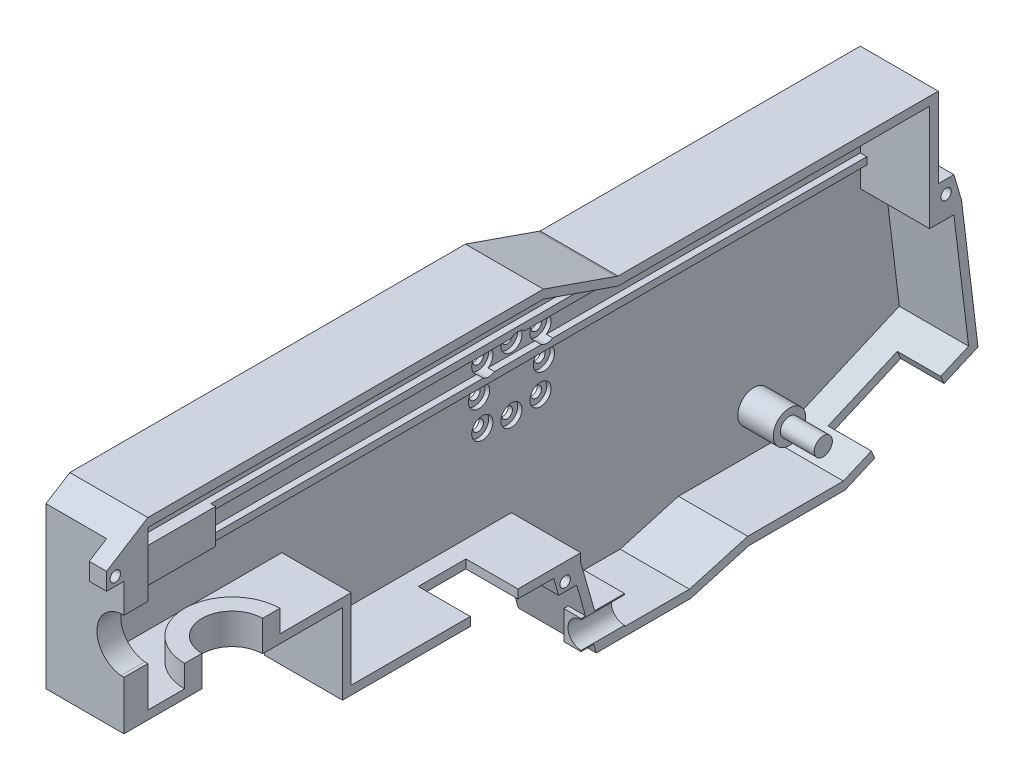
from build123d import *

# Parameters (mm, degrees)
SKETCH_1_W                   = 200
SKETCH_1_H                   = 65
SKETCH_1_R                   = 2.55
SKETCH_1_R_2                 = 2.2
EXTRUDE_1_DEPTH              = 2
SKETCH_2_W                   = 200
SKETCH_2_H                   = 2
EXTRUDE_2_DEPTH              = 16
SKETCH_3_R                   = 2.55
EXTRUDE_3_DEPTH              = 2.6
SKETCH_4_R                   = 4
SKETCH_4_R_2                 = 2.55
EXTRUDE_4_DEPTH              = 4.5
SKETCH_5_R                   = 2.2
EXTRUDE_5_DEPTH              = 16
SKETCH_6_R                   = 3.75
EXTRUDE_6_DEPTH              = 8.2
SKETCH_7_W                   = 200
SKETCH_7_H                   = 2
EXTRUDE_7_DEPTH              = 2
SKETCH_8_W                   = 165.45
SKETCH_8_H                   = 1.65
EXTRUDE_8_DEPTH              = 1.5
EXTRUDE_10_REACH             = 108.629
SKETCH_9_W                   = 5.5
SKETCH_9_H                   = 4
SKETCH_9_H_2                 = 4.5
SKETCH_9_H_3                 = 2
EXTRUDE_10_DIRECTION_2_REACH = 108.629
SKETCH_10_W                  = 5.5
SKETCH_10_H                  = 6.2
CUT_EXTRUDE_1_DEPTH          = 6.24
EXTRUDE_11_DEPTH             = 5.5
CUT_EXTRUDE_2_DEPTH          = 107.987148761
SKETCH_13_W                  = 2
SKETCH_13_H                  = 19
EXTRUDE_12_DEPTH             = 16
SKETCH_15_W                  = 11
SKETCH_15_H                  = 2
CUT_EXTRUDE_3_DEPTH          = 6.3
SKETCH_16_W                  = 7
SKETCH_16_H                  = 2
CUT_EXTRUDE_4_DEPTH          = 14
EXTRUDE_13_DEPTH             = 2
SKETCH_18_W                  = 14
SKETCH_18_H                  = 2
CUT_EXTRUDE_5_DEPTH          = 16
CUT_EXTRUDE_6_DEPTH          = 2
EXTRUDE_START                = -18
SKETCH_20_R                  = 25.5
SKETCH_20_R_2                = 22.7
EXTRUDE_14_DEPTH             = 24
SKETCH_21_W                  = 13
SKETCH_21_H                  = 4.7
EXTRUDE_15_DEPTH             = 2
SKETCH_22_R                  = 1.25
CUT_EXTRUDE_7_DEPTH          = 2
EXTRUDE_START_2              = 2
SKETCH_23_R                  = 22.7
SKETCH_23_R_2                = 1.25
EXTRUDE_17_DEPTH             = 2
CUT_EXTRUDE_START            = -16
CUT_EXTRUDE_10_DEPTH         = 16
CUT_EXTRUDE_START_2          = -17
CUT_EXTRUDE_10_2_OUTLINE_R   = 2.45
CUT_EXTRUDE_10_2_OUTLINE_R_2 = 1.25
CUT_EXTRUDE_10_2_DEPTH       = 1
EXTRUDE_START_3              = -1.5
EXTRUDE_18_DEPTH             = 1.5
SKETCH_28_W                  = 4
SKETCH_28_H                  = 4
SKETCH_28_R                  = 1.2
EXTRUDE_20_DEPTH             = 4
SKETCH_29_W                  = 4
SKETCH_29_H                  = 4
SKETCH_29_R                  = 1.2
EXTRUDE_21_DEPTH             = 4
EXTRUDE_22_DEPTH             = 4
SKETCH_31_W                  = 4
SKETCH_31_H                  = 4
SKETCH_31_R                  = 1.2
EXTRUDE_23_DEPTH             = 4
CUT_EXTRUDE_START_3          = -6
SKETCH_32_R                  = 25.5
CUT_EXTRUDE_11_DEPTH         = 6
CUT_EXTRUDE_12_DEPTH         = 16
SKETCH_35_W                  = 5.5
SKETCH_35_H                  = 3
SKETCH_35_W_2                = 2
SKETCH_35_H_2                = 2
EXTRUDE_26_DEPTH             = 16
EXTRUDE_START_4              = -2
EXTRUDE_30_DEPTH             = 2
SKETCH_38_W                  = 16
SKETCH_38_H                  = 5.5
EXTRUDE_31_DEPTH             = 6.3
CUT_EXTRUDE_START_4          = 5
CUT_EXTRUDE_13_DEPTH         = 5
CUT_EXTRUDE_START_5          = -5
CUT_EXTRUDE_14_DEPTH         = 5
CUT_EXTRUDE_15_DEPTH         = 9.7
SKETCH_42_W                  = 14
SKETCH_42_H                  = 2
CUT_EXTRUDE_17_DEPTH         = 12
EXTRUDE_35_REACH             = 113.212
EXTRUDE_35_DIRECTION_2_REACH = 113.212
EXTRUDE_36_DEPTH             = 2
CUT_EXTRUDE_18_DEPTH         = 2
EXTRUDE_37_REACH             = 114.296
SKETCH_47_W                  = 91.33315603
SKETCH_47_H                  = 4
EXTRUDE_38_DEPTH             = 2
SKETCH_48_W                  = 91.33315603
SKETCH_48_H                  = 2
CUT_EXTRUDE_19_DEPTH         = 16
CUT_EXTRUDE_20_DEPTH         = 14
CUT_EXTRUDE_21_DEPTH         = 16
SKETCH_51_R                  = 3.75
SKETCH_51_R_2                = 2.2
EXTRUDE_39_DEPTH             = 8.2
SKETCH_53_R                  = 2.1
EXTRUDE_40_DEPTH             = 7.8
SKETCH_54_R                  = 3.75
CUT_EXTRUDE_23_DEPTH         = 16
SKETCH_55_R                  = 2.2
EXTRUDE_42_DEPTH             = 2
EXTRUDE_43_DEPTH             = 4
SKETCH_57_W                  = 9
SKETCH_57_H                  = 2
EXTRUDE_44_DEPTH             = 12
SKETCH_58_W                  = 6
SKETCH_58_H                  = 2
CUT_EXTRUDE_24_DEPTH         = 12
CUT_EXTRUDE_START_6          = -4.5
SKETCH_59_R                  = 4
CUT_EXTRUDE_25_DEPTH         = 4.5
CUT_EXTRUDE_26_REACH         = 115.05
SKETCH_60_W                  = 12
SKETCH_60_H                  = 24.5
SKETCH_60_W_2                = 4
SKETCH_60_H_2                = 4
SKETCH_60_R                  = 1.2
SKETCH_61_W                  = 2
SKETCH_61_H                  = 28
CUT_EXTRUDE_27_DEPTH         = 114.049767802
EXTRUDE_45_DEPTH             = 18
CUT_EXTRUDE_28_DEPTH         = 10
SKETCH_64_R                  = 1.2
EXTRUDE_46_DEPTH             = 4
SKETCH_65_W                  = 5
SKETCH_65_H                  = 6.638569711
EXTRUDE_47_DEPTH             = 4
CUT_EXTRUDE_29_REACH         = 120.174
EXTRUDE_48_DEPTH             = 12
EXTRUDE_49_DEPTH             = 5.1


with BuildPart() as part:
    # 草图1 → 凸台-拉伸1 (new body)
    with BuildSketch(Plane(origin=(0, 0, 0), x_dir=(0, 0, -1), z_dir=(1, 0, 0))):
        Rectangle(SKETCH_1_W, SKETCH_1_H)
        with Locations((-88, 17.5)):
            Circle(SKETCH_1_R, mode=Mode.SUBTRACT)
        with Locations((61.45, -15.22)):
            Circle(SKETCH_1_R_2, mode=Mode.SUBTRACT)
    extrude(amount=EXTRUDE_1_DEPTH)

    # 草图3 → 凸台-拉伸3 (add)
    with BuildSketch(Plane(origin=(2, 0, 0), x_dir=(0, 0, -1), z_dir=(1, 0, 0))):
        Polygon((-65.45, 13.5), (-65.45, 17.5), (-65.45, 21.5), (-100, 21.5), (-100, 13.5), align=None)
        with Locations((-88, 17.5)):
            Circle(SKETCH_3_R, mode=Mode.SUBTRACT)
    extrude(amount=EXTRUDE_3_DEPTH)

    # 草图4 → 凸台-拉伸4 (add)
    with BuildSketch(Plane(origin=(4.6, 0, 0), x_dir=(0, 0, -1), z_dir=(1, 0, 0))):
        with Locations(Location((-88, 17.5, 0), (0, 0, 270))):
            Circle(SKETCH_4_R)
        with Locations((-88, 17.5)):
            Circle(SKETCH_4_R_2, mode=Mode.SUBTRACT)
    extrude(amount=EXTRUDE_4_DEPTH)



with BuildPart() as body_2:
    # 草图2 → 凸台-拉伸2 (new body)
    with BuildSketch(Plane(origin=(2, 0, 0), x_dir=(0, 0, -1), z_dir=(1, 0, 0))):
        with Locations((0, 33.5)):
            Rectangle(SKETCH_2_W, SKETCH_2_H)
    extrude(amount=EXTRUDE_2_DEPTH)


with BuildPart() as body_3:
    # 草图5 → 凸台-拉伸5 (new body)
    with BuildSketch(Plane(origin=(2, 0, 0), x_dir=(0, 0, -1), z_dir=(1, 0, 0))):
        with Locations((61.45, -15.22)):
            Circle(SKETCH_5_R)
    extrude(amount=EXTRUDE_5_DEPTH)


with BuildPart() as part_1:
    add(part.part)

    add(body_3.part)  # 凸台-拉伸6 merges body 3
    # 草图6 → 凸台-拉伸6 (add)
    with BuildSketch(Plane(origin=(2, 0, 0), x_dir=(0, 0, -1), z_dir=(1, 0, 0))):
        with Locations((61.45, -15.22)):
            Circle(SKETCH_6_R)
    extrude(amount=EXTRUDE_6_DEPTH)


    add(body_2.part)  # 凸台-拉伸7 merges body 2
    # 草图7 → 凸台-拉伸7 (add)
    with BuildSketch(Plane.ZY.offset(-2)):
        with Locations((0, 33.5)):
            Rectangle(SKETCH_7_W, SKETCH_7_H)
    extrude(amount=EXTRUDE_7_DEPTH)

    # 草图8 → 凸台-拉伸8 (add)
    with BuildSketch(Plane(origin=(2, 0, 0), x_dir=(0, 0, -1), z_dir=(1, 0, 0))):
        with Locations((17.275, 20.675)):
            Rectangle(SKETCH_8_W, SKETCH_8_H)
        with Locations((17.275, 14.325)):
            Rectangle(SKETCH_8_W, SKETCH_8_H)
    extrude(amount=EXTRUDE_8_DEPTH)

    # 凸台-拉伸10: up to this face of the body (flat: up to its plane)
    extrude_10_end = Plane(part_1.part.faces().sort_by_distance((18, 33.5, 0))[0])
    # 草图9 → 凸台-拉伸10 (add, up to the picked face)
    with BuildSketch(Plane(origin=(4.6, 0, 0), x_dir=(0, 0, -1), z_dir=(1, 0, 0)), mode=Mode.PRIVATE) as extrude_10_sk1:
        Polygon((-100, 21.5), (-94.5, 21.5), (-94.5, 32.5), (-100, 32.5), (-100, 28), align=None)
    extrude_10_tool1 = split(extrude(extrude_10_sk1.sketch, amount=EXTRUDE_10_REACH, mode=Mode.PRIVATE), bisect_by=extrude_10_end, keep=Keep.BOTH, mode=Mode.PRIVATE)
    # 草图9 → 凸台-拉伸10 (add, up to the picked face)
    with BuildSketch(Plane(origin=(4.6, 0, 0), x_dir=(0, 0, -1), z_dir=(1, 0, 0)), mode=Mode.PRIVATE) as extrude_10_sk2:
        with Locations((-97.25, 19.5)):
            Rectangle(SKETCH_9_W, SKETCH_9_H)
    extrude_10_tool2 = split(extrude(extrude_10_sk2.sketch, amount=EXTRUDE_10_REACH, mode=Mode.PRIVATE), bisect_by=extrude_10_end, keep=Keep.BOTH, mode=Mode.PRIVATE)
    # 草图9 → 凸台-拉伸10 (add, up to the picked face)
    with BuildSketch(Plane(origin=(4.6, 0, 0), x_dir=(0, 0, -1), z_dir=(1, 0, 0)), mode=Mode.PRIVATE) as extrude_10_sk3:
        with Locations((-97.25, 15.5)):
            Rectangle(SKETCH_9_W, SKETCH_9_H)
    extrude_10_tool3 = split(extrude(extrude_10_sk3.sketch, amount=EXTRUDE_10_REACH, mode=Mode.PRIVATE), bisect_by=extrude_10_end, keep=Keep.BOTH, mode=Mode.PRIVATE)
    # 草图9 → 凸台-拉伸10 (add, up to the picked face)
    with BuildSketch(Plane(origin=(4.6, 0, 0), x_dir=(0, 0, -1), z_dir=(1, 0, 0)), mode=Mode.PRIVATE) as extrude_10_sk4:
        with Locations((-97.25, 9.25)):
            Rectangle(SKETCH_9_W, SKETCH_9_H_2)
    extrude_10_tool4 = split(extrude(extrude_10_sk4.sketch, amount=EXTRUDE_10_REACH, mode=Mode.PRIVATE), bisect_by=extrude_10_end, keep=Keep.BOTH, mode=Mode.PRIVATE)
    # 草图9 → 凸台-拉伸10 (add, up to the picked face)
    with BuildSketch(Plane(origin=(4.6, 0, 0), x_dir=(0, 0, -1), z_dir=(1, 0, 0)), mode=Mode.PRIVATE) as extrude_10_sk5:
        with Locations((-97.25, 12.5)):
            Rectangle(SKETCH_9_W, SKETCH_9_H_3)
    extrude_10_tool5 = split(extrude(extrude_10_sk5.sketch, amount=EXTRUDE_10_REACH, mode=Mode.PRIVATE), bisect_by=extrude_10_end, keep=Keep.BOTH, mode=Mode.PRIVATE)
    add(extrude_10_tool1.solids().sort_by(Axis((4.6, 27, 97.25), (1, 0, 0)))[0])
    add(extrude_10_tool2.solids().sort_by(Axis((4.6, 19.5, 97.25), (1, 0, 0)))[0])
    add(extrude_10_tool3.solids().sort_by(Axis((4.6, 15.5, 97.25), (1, 0, 0)))[0])
    add(extrude_10_tool4.solids().sort_by(Axis((4.6, 9.25, 97.25), (1, 0, 0)))[0])
    add(extrude_10_tool5.solids().sort_by(Axis((4.6, 12.5, 97.25), (1, 0, 0)))[0])

    # 凸台-拉伸10 direction 2: up to this face of the body (flat: up to its plane)
    extrude_10_direction_2_end = Plane(part_1.part.faces().sort_by_distance((2, -9.47239987, 0.296508389))[0])
    # 草图9 → 凸台-拉伸10 direction 2 (add, up to the picked face)
    with BuildSketch(Plane(origin=(4.6, 0, 0), x_dir=(0, 0, -1), z_dir=(1, 0, 0)), mode=Mode.PRIVATE) as extrude_10_direction_2_sk1:
        Polygon((-100, 21.5), (-94.5, 21.5), (-94.5, 32.5), (-100, 32.5), (-100, 28), align=None)
    extrude_10_direction_2_tool1 = split(extrude(extrude_10_direction_2_sk1.sketch, amount=-EXTRUDE_10_DIRECTION_2_REACH, mode=Mode.PRIVATE), bisect_by=extrude_10_direction_2_end, keep=Keep.BOTH, mode=Mode.PRIVATE)
    # 草图9 → 凸台-拉伸10 direction 2 (add, up to the picked face)
    with BuildSketch(Plane(origin=(4.6, 0, 0), x_dir=(0, 0, -1), z_dir=(1, 0, 0)), mode=Mode.PRIVATE) as extrude_10_direction_2_sk2:
        with Locations((-97.25, 19.5)):
            Rectangle(SKETCH_9_W, SKETCH_9_H)
    extrude_10_direction_2_tool2 = split(extrude(extrude_10_direction_2_sk2.sketch, amount=-EXTRUDE_10_DIRECTION_2_REACH, mode=Mode.PRIVATE), bisect_by=extrude_10_direction_2_end, keep=Keep.BOTH, mode=Mode.PRIVATE)
    # 草图9 → 凸台-拉伸10 direction 2 (add, up to the picked face)
    with BuildSketch(Plane(origin=(4.6, 0, 0), x_dir=(0, 0, -1), z_dir=(1, 0, 0)), mode=Mode.PRIVATE) as extrude_10_direction_2_sk3:
        with Locations((-97.25, 15.5)):
            Rectangle(SKETCH_9_W, SKETCH_9_H)
    extrude_10_direction_2_tool3 = split(extrude(extrude_10_direction_2_sk3.sketch, amount=-EXTRUDE_10_DIRECTION_2_REACH, mode=Mode.PRIVATE), bisect_by=extrude_10_direction_2_end, keep=Keep.BOTH, mode=Mode.PRIVATE)
    # 草图9 → 凸台-拉伸10 direction 2 (add, up to the picked face)
    with BuildSketch(Plane(origin=(4.6, 0, 0), x_dir=(0, 0, -1), z_dir=(1, 0, 0)), mode=Mode.PRIVATE) as extrude_10_direction_2_sk4:
        with Locations((-97.25, 9.25)):
            Rectangle(SKETCH_9_W, SKETCH_9_H_2)
    extrude_10_direction_2_tool4 = split(extrude(extrude_10_direction_2_sk4.sketch, amount=-EXTRUDE_10_DIRECTION_2_REACH, mode=Mode.PRIVATE), bisect_by=extrude_10_direction_2_end, keep=Keep.BOTH, mode=Mode.PRIVATE)
    # 草图9 → 凸台-拉伸10 direction 2 (add, up to the picked face)
    with BuildSketch(Plane(origin=(4.6, 0, 0), x_dir=(0, 0, -1), z_dir=(1, 0, 0)), mode=Mode.PRIVATE) as extrude_10_direction_2_sk5:
        with Locations((-97.25, 12.5)):
            Rectangle(SKETCH_9_W, SKETCH_9_H_3)
    extrude_10_direction_2_tool5 = split(extrude(extrude_10_direction_2_sk5.sketch, amount=-EXTRUDE_10_DIRECTION_2_REACH, mode=Mode.PRIVATE), bisect_by=extrude_10_direction_2_end, keep=Keep.BOTH, mode=Mode.PRIVATE)
    add(extrude_10_direction_2_tool1.solids().sort_by(Axis((4.6, 27, 97.25), (-1, 0, 0)))[0])
    add(extrude_10_direction_2_tool2.solids().sort_by(Axis((4.6, 19.5, 97.25), (-1, 0, 0)))[0])
    add(extrude_10_direction_2_tool3.solids().sort_by(Axis((4.6, 15.5, 97.25), (-1, 0, 0)))[0])
    add(extrude_10_direction_2_tool4.solids().sort_by(Axis((4.6, 9.25, 97.25), (-1, 0, 0)))[0])
    add(extrude_10_direction_2_tool5.solids().sort_by(Axis((4.6, 12.5, 97.25), (-1, 0, 0)))[0])

    # 草图10 → 切除-拉伸1 (cut)
    with BuildSketch(Plane(origin=(18, 0, 0), x_dir=(0, 0, -1), z_dir=(1, 0, 0))):
        with Locations((-97.25, 20.6)):
            Rectangle(SKETCH_10_W, SKETCH_10_H)
        with Locations((-97.25, 14.4)):
            Rectangle(SKETCH_10_W, SKETCH_10_H)
    extrude(amount=-CUT_EXTRUDE_1_DEPTH, mode=Mode.SUBTRACT)

    # 草图11 → 凸台-拉伸11 (add)
    with BuildSketch(Plane.XY.offset(100)):
        with BuildLine():
            ThreePointArc((11.76, 17.5), (13.344930508, 21.655469652), (17.294592316, 23.7))
            Line((17.294592316, 23.7), (11.76, 23.7))
            Line((11.76, 23.7), (11.76, 17.5))
        make_face()
        with BuildLine():
            Line((11.76, 11.3), (17.294592316, 11.3))
            ThreePointArc((17.294592316, 11.3), (13.344930508, 13.344530348), (11.76, 17.5))
            Line((11.76, 17.5), (11.76, 11.3))
        make_face()
    extrude(amount=-EXTRUDE_11_DEPTH)

    # 草图12 → 切除-拉伸2 (cut, through all)
    with BuildSketch(Plane(origin=(2, 0, 0), x_dir=(0, 0, -1), z_dir=(1, 0, 0))):
        Polygon((-100, -32.5), (5.45, -32.5), (5.45, -15.22), (5.45, -13.5), (-44.55, -13.5), (-44.55, 5), (-94.5, 5), (-100, 5), align=None)
    extrude(amount=-CUT_EXTRUDE_2_DEPTH, mode=Mode.SUBTRACT)

    # 草图13 → 凸台-拉伸12 (add)
    with BuildSketch(Plane(origin=(2, 0, 0), x_dir=(0, 0, -1), z_dir=(1, 0, 0))):
        Polygon((-42.55, 7), (-92.5, 7), (-94.5, 7), (-100, 7), (-100, 5), (-44.55, 5), (-44.55, -13.5), (5.45, -13.5), (5.45, -32.5), (100, -32.5), (100, 13.5), (98, 13.5), (98, 11.5), (98, -30.5), (7.45, -30.5), (7.45, -11.5), (-42.55, -11.5), align=None)
        with Locations((99, 23)):
            Rectangle(SKETCH_13_W, SKETCH_13_H)
    extrude(amount=EXTRUDE_12_DEPTH)

    # 草图15 → 切除-拉伸3 (cut)
    with BuildSketch(Plane(origin=(18, 0, 0), x_dir=(0, 0, -1), z_dir=(1, 0, 0))):
        with Locations((-12.05, -12.5)):
            Rectangle(SKETCH_15_W, SKETCH_15_H)
    extrude(amount=-CUT_EXTRUDE_3_DEPTH, mode=Mode.SUBTRACT)

    # 草图16 → 切除-拉伸4 (cut)
    with BuildSketch(Plane(origin=(18, 0, 0), x_dir=(0, 0, -1), z_dir=(1, 0, 0))):
        with Locations((-78.5, 6)):
            Rectangle(SKETCH_16_W, SKETCH_16_H)
        with Locations((-71.5, 6)):
            Rectangle(SKETCH_16_W, SKETCH_16_H)
    extrude(amount=-CUT_EXTRUDE_4_DEPTH, mode=Mode.SUBTRACT)

    # 草图17 → 凸台-拉伸13 (add)
    with BuildSketch(Plane.XZ.offset(-5)):
        with BuildLine():
            ThreePointArc((18, 68), (11, 75), (18, 82))
            Line((18, 82), (4, 82))
            Line((4, 82), (4, 68))
            Line((4, 68), (18, 68))
        make_face()
    extrude(amount=-EXTRUDE_13_DEPTH)

    # 草图18 → 切除-拉伸5 (cut)
    with BuildSketch(Plane(origin=(18, 0, 0), x_dir=(0, 0, -1), z_dir=(1, 0, 0))):
        with Locations((91, -31.5)):
            Rectangle(SKETCH_18_W, SKETCH_18_H)
    extrude(amount=-CUT_EXTRUDE_5_DEPTH, mode=Mode.SUBTRACT)

    # 草图19 → 切除-拉伸6 (cut)
    with BuildSketch(Plane(origin=(2, 0, 0), x_dir=(0, 0, -1), z_dir=(1, 0, 0))):
        Polygon((-2.8, 19.85), (-2.8, 17.5), (-2.8, 15.15), (10.2, 15.15), (10.2, 19.85), align=None)
    extrude(amount=-CUT_EXTRUDE_6_DEPTH, mode=Mode.SUBTRACT)

    # 草图20 → 凸台-拉伸14 (add)
    with BuildSketch(Plane.ZY.offset(EXTRUDE_START)):
        with Locations((-5.45, 10.5)):
            Circle(SKETCH_20_R)
        with Locations((-5.45, 10.5)):
            Circle(SKETCH_20_R_2, mode=Mode.SUBTRACT)
    extrude(amount=EXTRUDE_14_DEPTH)

    # 草图21 → 凸台-拉伸15 (add)
    with BuildSketch(Plane.ZY):
        with Locations((-3.7, 17.5)):
            Rectangle(SKETCH_21_W, SKETCH_21_H)
    extrude(amount=-EXTRUDE_15_DEPTH)

    # 草图22 → 切除-拉伸7 (cut)
    with BuildSketch(Plane.ZY):
        with Locations((-5.45, 3)):
            Circle(SKETCH_22_R)
        with Locations((-12.167514421, 3.782485579)):
            Circle(SKETCH_22_R)
        with Locations((-12.95, 10.5)):
            Circle(SKETCH_22_R)
        with Locations((-12.167514421, 17.217514421)):
            Circle(SKETCH_22_R)
        with Locations((-5.45, 18)):
            Circle(SKETCH_22_R)
        with Locations((1.267514421, 17.217514421)):
            Circle(SKETCH_22_R)
        with Locations((2.05, 10.5)):
            Circle(SKETCH_22_R)
        with Locations((1.267514421, 3.782485579)):
            Circle(SKETCH_22_R)
    extrude(amount=-CUT_EXTRUDE_7_DEPTH, mode=Mode.SUBTRACT)

    # 草图23 → 凸台-拉伸17 (add)
    with BuildSketch(Plane.ZY.offset(EXTRUDE_START_2)):
        with Locations((-5.45, 10.5)):
            Circle(SKETCH_23_R)
        with Locations((1.267514421, 3.782485579)):
            Circle(SKETCH_23_R_2, mode=Mode.SUBTRACT)
        with Locations((2.05, 10.5)):
            Circle(SKETCH_23_R_2, mode=Mode.SUBTRACT)
        with Locations((1.267514421, 17.217514421)):
            Circle(SKETCH_23_R_2, mode=Mode.SUBTRACT)
        with Locations((-5.45, 18)):
            Circle(SKETCH_23_R_2, mode=Mode.SUBTRACT)
        with Locations((-12.167514421, 17.217514421)):
            Circle(SKETCH_23_R_2, mode=Mode.SUBTRACT)
        with Locations((-12.95, 10.5)):
            Circle(SKETCH_23_R_2, mode=Mode.SUBTRACT)
        with Locations((-12.167514421, 3.782485579)):
            Circle(SKETCH_23_R_2, mode=Mode.SUBTRACT)
        with Locations((-5.45, 3)):
            Circle(SKETCH_23_R_2, mode=Mode.SUBTRACT)
    extrude(amount=-EXTRUDE_17_DEPTH)

    # 切除-拉伸10: read off the stored shape, not the designer's step
    # 切除-拉伸10 outline → 切除-拉伸10 (cut)
    with BuildSketch(Plane(origin=(18, 0, 0), x_dir=(0, 0, -1), z_dir=(1, 0, 0)).offset(CUT_EXTRUDE_START)):
        with BuildLine():
            Line((7.45, -12.111722623), (7.45, -14.921447638))
            ThreePointArc((7.45, -14.921447638), (25.162434806, -5.676214453), (30.772914524, 13.5))
            ThreePointArc((30.772914524, 13.5), (30.66118187, 14.327049613), (30.522445034, 15.15))
            ThreePointArc((30.522445034, 15.15), (29.961128378, 17.532395439), (29.173985752, 19.85))
            ThreePointArc((29.173985752, 19.85), (28.829270645, 20.681340978), (28.455434141, 21.5))
            ThreePointArc((28.455434141, 21.5), (24.22335075, 27.757210134), (18.343796958, 32.5))
            Line((18.343796958, 32.5), (11.043746508, 32.5))
            ThreePointArc((11.043746508, 32.5), (19.312964197, 28.475211367), (25.306736892, 21.5))
            ThreePointArc((25.306736892, 21.5), (25.737628923, 20.683423426), (26.134958303, 19.85))
            ThreePointArc((26.134958303, 19.85), (27.030128894, 17.54187737), (27.66862957, 15.15))
            ThreePointArc((27.66862957, 15.15), (27.824973909, 14.327602719), (27.950888871, 13.5))
            ThreePointArc((27.950888871, 13.5), (23.171836045, -3.685433627), (7.45, -12.111722623))
        make_face()
        with BuildLine():
            Line((-7.443796958, -11.5), (-0.143746508, -11.5))
            ThreePointArc((-0.143746508, -11.5), (-13.353646834, -2.216637359), (-17.050888871, 13.5))
            ThreePointArc((-17.050888871, 13.5), (-16.924973909, 14.327602719), (-16.768629571, 15.15))
            ThreePointArc((-16.768629571, 15.15), (-16.130128895, 17.54187737), (-15.234958303, 19.85))
            ThreePointArc((-15.234958303, 19.85), (-14.837628923, 20.683423426), (-14.406736892, 21.5))
            ThreePointArc((-14.406736892, 21.5), (-8.412964197, 28.475211367), (-0.143746508, 32.5))
            Line((-0.143746508, 32.5), (-7.443796958, 32.5))
            ThreePointArc((-7.443796958, 32.5), (-13.32335075, 27.757210134), (-17.555434141, 21.5))
            ThreePointArc((-17.555434141, 21.5), (-17.929270645, 20.681340978), (-18.273985753, 19.85))
            ThreePointArc((-18.273985753, 19.85), (-19.061128378, 17.532395439), (-19.622445034, 15.15))
            ThreePointArc((-19.622445034, 15.15), (-19.76118187, 14.327049613), (-19.872914524, 13.5))
            ThreePointArc((-19.872914524, 13.5), (-17.383730732, -0.852124949), (-7.443796958, -11.5))
        make_face()
        with BuildLine():
            ThreePointArc((10.853024361, 15.15), (12.167514421, 14.767514421), (13.482004481, 15.15))
            Line((13.482004481, 15.15), (10.853024361, 15.15))
        make_face()
        with BuildLine():
            Line((0.046975639, 15.15), (-2.582004481, 15.15))
            ThreePointArc((-2.582004481, 15.15), (-1.267514421, 14.767514421), (0.046975639, 15.15))
        make_face()
        with BuildLine():
            Line((3.84376216, 19.85), (7.05623784, 19.85))
            ThreePointArc((7.05623784, 19.85), (5.45, 20.45), (3.84376216, 19.85))
        make_face()
    extrude(amount=CUT_EXTRUDE_10_DEPTH, mode=Mode.SUBTRACT)

    # Cut-Extrude 10 2 outline → Cut-Extrude 10 2 (cut)
    # profile 1 of 8: a face of its own
    with BuildSketch(Plane(origin=(18, 0, 0), x_dir=(0, 0, -1), z_dir=(1, 0, 0)).offset(CUT_EXTRUDE_START_2)):
        with Locations((12.167514421, 17.217514421)):
            Circle(CUT_EXTRUDE_10_2_OUTLINE_R)
        with Locations((12.167514421, 17.217514421)):
            Circle(CUT_EXTRUDE_10_2_OUTLINE_R_2, mode=Mode.SUBTRACT)
    # profile 2 of 8: a face of its own
    with BuildSketch(Plane(origin=(18, 0, 0), x_dir=(0, 0, -1), z_dir=(1, 0, 0)).offset(CUT_EXTRUDE_START_2)):
        with Locations((-1.267514421, 17.217514421)):
            Circle(CUT_EXTRUDE_10_2_OUTLINE_R)
        with Locations((-1.267514421, 17.217514421)):
            Circle(CUT_EXTRUDE_10_2_OUTLINE_R_2, mode=Mode.SUBTRACT)
    # profile 3 of 8: a face of its own
    with BuildSketch(Plane(origin=(18, 0, 0), x_dir=(0, 0, -1), z_dir=(1, 0, 0)).offset(CUT_EXTRUDE_START_2)):
        with Locations((5.45, 18)):
            Circle(CUT_EXTRUDE_10_2_OUTLINE_R)
        with Locations((5.45, 18)):
            Circle(CUT_EXTRUDE_10_2_OUTLINE_R_2, mode=Mode.SUBTRACT)
    # profile 4 of 8: a face of its own
    with BuildSketch(Plane(origin=(18, 0, 0), x_dir=(0, 0, -1), z_dir=(1, 0, 0)).offset(CUT_EXTRUDE_START_2)):
        with Locations((-1.267514421, 3.782485579)):
            Circle(CUT_EXTRUDE_10_2_OUTLINE_R)
        with Locations((-1.267514421, 3.782485579)):
            Circle(CUT_EXTRUDE_10_2_OUTLINE_R_2, mode=Mode.SUBTRACT)
    # profile 5 of 8: a face of its own
    with BuildSketch(Plane(origin=(18, 0, 0), x_dir=(0, 0, -1), z_dir=(1, 0, 0)).offset(CUT_EXTRUDE_START_2)):
        with Locations((-2.05, 10.5)):
            Circle(CUT_EXTRUDE_10_2_OUTLINE_R)
        with Locations((-2.05, 10.5)):
            Circle(CUT_EXTRUDE_10_2_OUTLINE_R_2, mode=Mode.SUBTRACT)
    # profile 6 of 8: a face of its own
    with BuildSketch(Plane(origin=(18, 0, 0), x_dir=(0, 0, -1), z_dir=(1, 0, 0)).offset(CUT_EXTRUDE_START_2)):
        with Locations((12.95, 10.5)):
            Circle(CUT_EXTRUDE_10_2_OUTLINE_R)
        with Locations((12.95, 10.5)):
            Circle(CUT_EXTRUDE_10_2_OUTLINE_R_2, mode=Mode.SUBTRACT)
    # profile 7 of 8: a face of its own
    with BuildSketch(Plane(origin=(18, 0, 0), x_dir=(0, 0, -1), z_dir=(1, 0, 0)).offset(CUT_EXTRUDE_START_2)):
        with Locations((12.167514421, 3.782485579)):
            Circle(CUT_EXTRUDE_10_2_OUTLINE_R)
        with Locations((12.167514421, 3.782485579)):
            Circle(CUT_EXTRUDE_10_2_OUTLINE_R_2, mode=Mode.SUBTRACT)
    # profile 8 of 8: a face of its own
    with BuildSketch(Plane(origin=(18, 0, 0), x_dir=(0, 0, -1), z_dir=(1, 0, 0)).offset(CUT_EXTRUDE_START_2)):
        with Locations((5.45, 3)):
            Circle(CUT_EXTRUDE_10_2_OUTLINE_R)
        with Locations((5.45, 3)):
            Circle(CUT_EXTRUDE_10_2_OUTLINE_R_2, mode=Mode.SUBTRACT)
    extrude(amount=CUT_EXTRUDE_10_2_DEPTH, mode=Mode.SUBTRACT)

    # 草图26 → 凸台-拉伸18 (add)
    with BuildSketch(Plane(origin=(3.5, 0, 0), x_dir=(0, 0, -1), z_dir=(1, 0, 0)).offset(EXTRUDE_START_3)):
        with BuildLine():
            ThreePointArc((-14.406736892, 21.5), (-14.837628923, 20.683423426), (-15.234958303, 19.85))
            Line((-15.234958303, 19.85), (-18.273985753, 19.85))
            ThreePointArc((-18.273985753, 19.85), (-17.929270645, 20.681340978), (-17.555434141, 21.5))
            Line((-17.555434141, 21.5), (-14.406736892, 21.5))
        make_face()
        with BuildLine():
            ThreePointArc((-16.768629571, 15.15), (-16.924973909, 14.327602719), (-17.050888871, 13.5))
            Line((-17.050888871, 13.5), (-19.872914524, 13.5))
            ThreePointArc((-19.872914524, 13.5), (-19.76118187, 14.327049613), (-19.622445034, 15.15))
            Line((-19.622445034, 15.15), (-16.768629571, 15.15))
        make_face()
        with BuildLine():
            ThreePointArc((26.134958303, 19.85), (25.737628923, 20.683423426), (25.306736892, 21.5))
            Line((25.306736892, 21.5), (28.455434141, 21.5))
            ThreePointArc((28.455434141, 21.5), (28.829270645, 20.681340978), (29.173985753, 19.85))
            Line((29.173985753, 19.85), (26.134958303, 19.85))
        make_face()
        with BuildLine():
            Line((30.772914524, 13.5), (27.950888871, 13.5))
            ThreePointArc((27.950888871, 13.5), (27.824973909, 14.327602719), (27.668629571, 15.15))
            Line((27.668629571, 15.15), (30.522445034, 15.15))
            ThreePointArc((30.522445034, 15.15), (30.66118187, 14.327049613), (30.772914524, 13.5))
        make_face()
    extrude(amount=EXTRUDE_18_DEPTH)

    # 草图28 → 凸台-拉伸20 (add)
    with BuildSketch(Plane(origin=(18, 0, 0), x_dir=(0, 0, -1), z_dir=(1, 0, 0))):
        with Locations((102, 32.5)):
            Rectangle(SKETCH_28_W, SKETCH_28_H)
        with Locations((102, 32.5)):
            Circle(SKETCH_28_R, mode=Mode.SUBTRACT)
    extrude(amount=-EXTRUDE_20_DEPTH)

    # 草图29 → 凸台-拉伸21 (add)
    with BuildSketch(Plane(origin=(18, 0, 0), x_dir=(0, 0, -1), z_dir=(1, 0, 0))):
        with Locations((102, -30.5)):
            Rectangle(SKETCH_29_W, SKETCH_29_H)
        with Locations((102, -30.5)):
            Circle(SKETCH_29_R, mode=Mode.SUBTRACT)
    extrude(amount=-EXTRUDE_21_DEPTH)

    # 草图30 → 凸台-拉伸22 (add)
    with BuildSketch(Plane(origin=(18, 0, 0), x_dir=(0, 0, -1), z_dir=(1, 0, 0))):
        with BuildLine():
            Line((2.058047025, -16.447242322), (0.45, -15))
            Line((0.45, -15), (0.45, -19.5))
            Line((0.45, -19.5), (5.45, -19.5))
            Line((5.45, -19.5), (3.841952975, -18.052757678))
            ThreePointArc((3.841952975, -18.052757678), (2.147242322, -18.141952975), (2.058047025, -16.447242322))
        make_face()
        with BuildLine():
            Line((5.45, -15), (0.45, -15))
            Line((0.45, -15), (2.058047025, -16.447242322))
            ThreePointArc((2.058047025, -16.447242322), (3.379916521, -16.129655506), (4.15, -17.25))
            ThreePointArc((4.15, -17.25), (4.070344494, -17.679916521), (3.841952975, -18.052757678))
            Line((3.841952975, -18.052757678), (5.45, -19.5))
            Line((5.45, -19.5), (5.45, -15))
        make_face()
        with BuildLine():
            Line((0.45, -19.5), (0.45, -15))
            Line((0.45, -15), (5.45, -15))
            ThreePointArc((5.45, -15), (1.076786079, -14.622201337), (-3.16684397, -13.5))
            Line((-3.16684397, -13.5), (-3.16684397, -19.5))
            Line((-3.16684397, -19.5), (0.45, -19.5))
        make_face()
    extrude(amount=-EXTRUDE_22_DEPTH)

    # 草图31 → 凸台-拉伸23 (add)
    with BuildSketch(Plane(origin=(18, 0, 0), x_dir=(0, 0, -1), z_dir=(1, 0, 0))):
        with Locations((-102, 32.5)):
            Rectangle(SKETCH_31_W, SKETCH_31_H)
        with Locations((-102, 32.5)):
            Circle(SKETCH_31_R, mode=Mode.SUBTRACT)
    extrude(amount=-EXTRUDE_23_DEPTH)

    # 草图32 → 切除-拉伸11 (cut)
    with BuildSketch(Plane.ZY.offset(6).offset(CUT_EXTRUDE_START_3)):
        with Locations((-5.45, 10.5)):
            Circle(SKETCH_32_R)
    extrude(amount=CUT_EXTRUDE_11_DEPTH, mode=Mode.SUBTRACT)

    # 草图34 → 切除-拉伸12 (cut)
    with BuildSketch(Plane(origin=(18, 0, 0), x_dir=(0, 0, -1), z_dir=(1, 0, 0))):
        Polygon((-68, 7), (-68, 5), (-44.55, 5), (-44.55, -13.5), (-17.55, -13.5), (-17.55, -11.5), (-42.55, -11.5), (-42.55, 7), align=None)
        Polygon((-100, 5), (-82, 5), (-82, 7), (-94.5, 7), (-94.5, 11.3), (-100, 11.3), align=None)
        with BuildLine():
            Line((-3.16684397, -19.5), (5.45, -19.5))
            Line((5.45, -19.5), (5.45, -32.5))
            Line((5.45, -32.5), (84, -32.5))
            Line((84, -32.5), (84, -30.5))
            Line((84, -30.5), (7.45, -30.5))
            Line((7.45, -30.5), (7.45, -11.5))
            Line((7.45, -11.5), (-7.443796958, -11.5))
            ThreePointArc((-7.443796958, -11.5), (-6.999408892, -11.754487598), (-6.55, -12))
            Line((-6.55, -12), (-6.55, -13.5))
            Line((-6.55, -13.5), (-3.16684397, -13.5))
            Line((-3.16684397, -13.5), (-3.16684397, -19.5))
        make_face()
    extrude(amount=-CUT_EXTRUDE_12_DEPTH, mode=Mode.SUBTRACT)



with BuildPart() as body_2_2:
    # 草图35 → 凸台-拉伸26 (new body)
    with BuildSketch(Plane(origin=(2, 0, 0), x_dir=(0, 0, -1), z_dir=(1, 0, 0))):
        Polygon((-49.55, 2), (-94.5, 2), (-100, 2), (-100, 0), (-49.55, 0), align=None)
        with Locations((-97.25, 3.5)):
            Rectangle(SKETCH_35_W, SKETCH_35_H)
        with Locations((-48.55, 1)):
            Rectangle(SKETCH_35_W_2, SKETCH_35_H_2)
        Polygon((-47.55, 0), (-49.55, 0), (-49.55, -13.5), (-49.55, -18.5), (-44.55, -18.5), (5.45, -18.5), (5.45, -16.5), (-44.55, -16.5), (-47.55, -16.5), (-47.55, -13.5), align=None)
    extrude(amount=EXTRUDE_26_DEPTH)


with BuildPart() as part_2:
    add(part_1.part)

    add(body_2_2.part)  # 凸台-拉伸30 merges body 2 2
    # 草图37 → 凸台-拉伸30 (add)
    with BuildSketch(Plane.ZY.offset(EXTRUDE_START_4)):
        with BuildLine():
            Line((-5.45, -15), (-5.45, -16.5))
            Line((-5.45, -16.5), (47.55, -16.5))
            Line((47.55, -16.5), (47.55, 2))
            Line((47.55, 2), (94.5, 2))
            Line((94.5, 2), (94.5, 5))
            Line((94.5, 5), (44.55, 5))
            Line((44.55, 5), (44.55, -13.5))
            Line((44.55, -13.5), (3.16684397, -13.5))
            ThreePointArc((3.16684397, -13.5), (-1.076786079, -14.622201337), (-5.45, -15))
        make_face()
        Polygon((-5.45, -16.5), (-5.45, -18.5), (49.55, -18.5), (49.55, 0), (100, 0), (100, 5), (94.5, 5), (94.5, 2), (47.55, 2), (47.55, -16.5), align=None)
    extrude(amount=EXTRUDE_30_DEPTH)

    # 草图38 → 凸台-拉伸31 (add)
    with BuildSketch(Plane(origin=(0, 5, 0), x_dir=(1, 0, 0), z_dir=(0, 1, 0))):
        with Locations((10, -97.25)):
            Rectangle(SKETCH_38_W, SKETCH_38_H)
    extrude(amount=EXTRUDE_31_DEPTH)

    # 草图39 → 切除-拉伸13 (cut)
    with BuildSketch(Plane.XZ.offset(-5).offset(CUT_EXTRUDE_START_4)):
        with BuildLine():
            Line((18, 82), (18, 68))
            ThreePointArc((18, 68), (11, 75), (18, 82))
        make_face()
    extrude(amount=-CUT_EXTRUDE_13_DEPTH, mode=Mode.SUBTRACT)

    # 草图40 → 切除-拉伸14 (cut)
    with BuildSketch(Plane(origin=(0, 7, 0), x_dir=(1, 0, 0), z_dir=(0, 1, 0)).offset(CUT_EXTRUDE_START_5)):
        with BuildLine():
            Line((2, -82), (18, -82))
            ThreePointArc((18, -82), (11, -75), (18, -68))
            Line((18, -68), (2, -68))
            Line((2, -68), (2, -82))
        make_face()
    extrude(amount=CUT_EXTRUDE_14_DEPTH, mode=Mode.SUBTRACT)

    # 草图41 → 切除-拉伸15 (cut)
    with BuildSketch(Plane(origin=(11.7, 0, 0), x_dir=(0, 0, -1), z_dir=(1, 0, 0))):
        with BuildLine():
            Line((-7.443796958, -11.5), (-17.55, -11.5))
            Line((-17.55, -11.5), (-17.55, -13.5))
            Line((-17.55, -13.5), (-6.55, -13.5))
            Line((-6.55, -13.5), (-6.55, -12))
            ThreePointArc((-6.55, -12), (-6.999408892, -11.754487598), (-7.443796958, -11.5))
        make_face()
    extrude(amount=-CUT_EXTRUDE_15_DEPTH, mode=Mode.SUBTRACT)

    # 草图42 → 切除-拉伸17 (cut)
    with BuildSketch(Plane(origin=(18, 0, 0), x_dir=(0, 0, -1), z_dir=(1, 0, 0))):
        with Locations((-22.05, -17.5)):
            Rectangle(SKETCH_42_W, SKETCH_42_H)
    extrude(amount=-CUT_EXTRUDE_17_DEPTH, mode=Mode.SUBTRACT)

    # 凸台-拉伸35: up to this face of the body (flat: up to its plane)
    extrude_35_end = Plane(part_2.part.faces().sort_by_distance((0, 5.465117103, -12.835241275))[0])
    # 草图43 → 凸台-拉伸35 (add, up to the picked face)
    with BuildSketch(Plane(origin=(2, 0, 0), x_dir=(0, 0, -1), z_dir=(1, 0, 0)), mode=Mode.PRIVATE) as extrude_35_sk1:
        Polygon((5.45, -18.5), (3.369968603, -18.5), (9.040281686, -38.346095791), (30.828994401, -38.346095791), (44.290329668, -34.5), (100, -34.5), (100, -32.5), (44.010219779, -32.5), (30.548884512, -36.346095791), (10.548884512, -36.346095791), align=None)
    extrude_35_tool1 = split(extrude(extrude_35_sk1.sketch, amount=-EXTRUDE_35_REACH, mode=Mode.PRIVATE), bisect_by=extrude_35_end, keep=Keep.BOTH, mode=Mode.PRIVATE)
    add(extrude_35_tool1.solids().sort_by(Axis((2, -33.485496, -46.318564), (-1, 0, 0)))[0])

    # 凸台-拉伸35 direction 2: up to this face of the body (flat: up to its plane)
    extrude_35_direction_2_end = Plane(part_2.part.faces().sort_by_distance((18, -8.258050479, 48.533050479))[0])
    # 草图43 → 凸台-拉伸35 direction 2 (add, up to the picked face)
    with BuildSketch(Plane(origin=(2, 0, 0), x_dir=(0, 0, -1), z_dir=(1, 0, 0)), mode=Mode.PRIVATE) as extrude_35_direction_2_sk1:
        Polygon((5.45, -18.5), (3.369968603, -18.5), (9.040281686, -38.346095791), (30.828994401, -38.346095791), (44.290329668, -34.5), (100, -34.5), (100, -32.5), (44.010219779, -32.5), (30.548884512, -36.346095791), (10.548884512, -36.346095791), align=None)
    extrude_35_direction_2_tool1 = split(extrude(extrude_35_direction_2_sk1.sketch, amount=EXTRUDE_35_DIRECTION_2_REACH, mode=Mode.PRIVATE), bisect_by=extrude_35_direction_2_end, keep=Keep.BOTH, mode=Mode.PRIVATE)
    add(extrude_35_direction_2_tool1.solids().sort_by(Axis((2, -33.485496, -46.318564), (1, 0, 0)))[0])

    # 草图44 → 凸台-拉伸36 (add)
    with BuildSketch(Plane(origin=(2, 0, 0), x_dir=(0, 0, -1), z_dir=(1, 0, 0))):
        Polygon((44.010219779, -32.5), (9.45, -32.5), (10.548884512, -36.346095791), (30.548884512, -36.346095791), align=None)
    extrude(amount=-EXTRUDE_36_DEPTH)

    # 草图45 → 切除-拉伸18 (cut)
    with BuildSketch(Plane(origin=(2, 0, 0), x_dir=(0, 0, -1), z_dir=(1, 0, 0))):
        Polygon((7.369968603, -32.5), (5.45, -25.780109889), (5.45, -32.5), align=None)
    extrude(amount=-CUT_EXTRUDE_18_DEPTH, mode=Mode.SUBTRACT)

    # 凸台-拉伸37: up to this face of the body (flat: up to its plane)
    extrude_37_end = Plane(part_2.part.faces().sort_by_distance((0, 4.411657354, -13.61181875))[0])
    # 草图46 → 凸台-拉伸37 (add, up to the picked face)
    with BuildSketch(Plane(origin=(18, 0, 0), x_dir=(0, 0, -1), z_dir=(1, 0, 0)), mode=Mode.PRIVATE) as extrude_37_sk1:
        with BuildLine():
            Line((-104, 34.5), (-94.5, 34.5))
            Line((-94.5, 34.5), (-94.5, 38.5))
            Line((-94.5, 38.5), (-3.16684397, 38.5))
            Line((-3.16684397, 38.5), (-3.16684397, 34.5))
            ThreePointArc((-3.16684397, 34.5), (5.203401519, 35.998807603), (13.60106862, 34.662162162))
            Line((13.60106862, 34.662162162), (-3.16684397, 40.5))
            Line((-3.16684397, 40.5), (-94.5, 40.5))
            Line((-94.5, 40.5), (-104, 34.5))
        make_face()
    extrude_37_tool1 = split(extrude(extrude_37_sk1.sketch, amount=-EXTRUDE_37_REACH, mode=Mode.PRIVATE), bisect_by=extrude_37_end, keep=Keep.BOTH, mode=Mode.PRIVATE)
    add(extrude_37_tool1.solids().sort_by(Axis((18, 38.830648, 47.50919), (-1, 0, 0)))[0])

    # 草图47 → 凸台-拉伸38 (add)
    with BuildSketch(Plane.ZY):
        with Locations((48.833421985, 36.5)):
            Rectangle(SKETCH_47_W, SKETCH_47_H)
    extrude(amount=-EXTRUDE_38_DEPTH)

    # 草图48 → 切除-拉伸19 (cut)
    with BuildSketch(Plane(origin=(18, 0, 0), x_dir=(0, 0, -1), z_dir=(1, 0, 0))):
        with Locations((-48.833421985, 33.5)):
            Rectangle(SKETCH_48_W, SKETCH_48_H)
    extrude(amount=-CUT_EXTRUDE_19_DEPTH, mode=Mode.SUBTRACT)

    # 草图49 → 切除-拉伸20 (cut)
    with BuildSketch(Plane.ZY):
        Polygon((100, 37.026315789), (100, 34.5), (104, 34.5), align=None)
    extrude(amount=-CUT_EXTRUDE_20_DEPTH, mode=Mode.SUBTRACT)

    # 草图50 → 切除-拉伸21 (cut)
    with BuildSketch(Plane(origin=(18, 0, 0), x_dir=(0, 0, -1), z_dir=(1, 0, 0))):
        Polygon((14.06684397, 32.5), (-3.16684397, 38.5), (-3.16684397, 32.5), align=None)
    extrude(amount=-CUT_EXTRUDE_21_DEPTH, mode=Mode.SUBTRACT)

    # 草图51 → 凸台-拉伸39 (add)
    # profile 1 of 2: a face of its own
    with BuildSketch(Plane(origin=(2, 0, 0), x_dir=(0, 0, -1), z_dir=(1, 0, 0))):
        with Locations((61.45, -23.22)):
            Circle(SKETCH_51_R)
        with Locations((61.45, -23.22)):
            Circle(SKETCH_51_R_2, mode=Mode.SUBTRACT)
    # profile 2 of 2: a face of its own
    with BuildSketch(Plane(origin=(2, 0, 0), x_dir=(0, 0, -1), z_dir=(1, 0, 0))):
        with Locations((61.45, -23.22)):
            Circle(SKETCH_51_R_2)
    extrude(amount=EXTRUDE_39_DEPTH)

    # 草图53 → 凸台-拉伸40 (add)
    with BuildSketch(Plane(origin=(10.2, 0, 0), x_dir=(0, 0, -1), z_dir=(1, 0, 0))):
        with Locations((61.45, -23.22)):
            Circle(SKETCH_53_R)
    extrude(amount=EXTRUDE_40_DEPTH)

    # 草图54 → 切除-拉伸23 (cut)
    with BuildSketch(Plane(origin=(18, 0, 0), x_dir=(0, 0, -1), z_dir=(1, 0, 0)).offset(CUT_EXTRUDE_START)):
        with Locations((61.45, -15.22)):
            Circle(SKETCH_54_R)
    extrude(amount=CUT_EXTRUDE_23_DEPTH, mode=Mode.SUBTRACT)

    # 草图55 → 凸台-拉伸42 (add)
    with BuildSketch(Plane(origin=(2, 0, 0), x_dir=(0, 0, -1), z_dir=(1, 0, 0)).offset(EXTRUDE_START_4)):
        with Locations((61.45, -15.22)):
            Circle(SKETCH_55_R)
    extrude(amount=EXTRUDE_42_DEPTH)

    # 草图56 → 凸台-拉伸43 (add)
    with BuildSketch(Plane(origin=(18, 0, 0), x_dir=(0, 0, -1), z_dir=(1, 0, 0))):
        with BuildLine():
            Line((-0.790094191, -18.5), (0.352762952, -22.5))
            Line((0.352762952, -22.5), (1.138731162, -21.458018378))
            ThreePointArc((1.138731162, -21.458018378), (0.9033474, -19.777365384), (2.584000393, -19.541981622))
            Line((2.584000393, -19.541981622), (3.369968603, -18.5))
            Line((3.369968603, -18.5), (-0.790094191, -18.5))
        make_face()
        with BuildLine():
            Line((1.138731162, -21.458018378), (0.352762952, -22.5))
            Line((0.352762952, -22.5), (4.512825746, -22.5))
            Line((4.512825746, -22.5), (3.369968603, -18.5))
            Line((3.369968603, -18.5), (2.584000393, -19.541981622))
            ThreePointArc((2.584000393, -19.541981622), (2.935414552, -19.964818507), (3.061365778, -20.5))
            ThreePointArc((3.061365778, -20.5), (2.396547271, -21.574048774), (1.138731162, -21.458018378))
        make_face()
    extrude(amount=-EXTRUDE_43_DEPTH)

    # 草图57 → 凸台-拉伸44 (add)
    with BuildSketch(Plane(origin=(6, 0, 0), x_dir=(0, 0, -1), z_dir=(1, 0, 0))):
        with Locations((-24.55, -17.5)):
            Rectangle(SKETCH_57_W, SKETCH_57_H)
    extrude(amount=EXTRUDE_44_DEPTH)

    # 草图58 → 切除-拉伸24 (cut)
    with BuildSketch(Plane(origin=(18, 0, 0), x_dir=(0, 0, -1), z_dir=(1, 0, 0))):
        with Locations((-12.05, -17.5)):
            Rectangle(SKETCH_58_W, SKETCH_58_H)
    extrude(amount=-CUT_EXTRUDE_24_DEPTH, mode=Mode.SUBTRACT)

    # 草图59 → 切除-拉伸25 (cut)
    with BuildSketch(Plane(origin=(9.1, 0, 0), x_dir=(0, 0, -1), z_dir=(1, 0, 0)).offset(CUT_EXTRUDE_START_6)):
        with Locations((-88, 17.5)):
            Circle(SKETCH_59_R)
    extrude(amount=CUT_EXTRUDE_25_DEPTH, mode=Mode.SUBTRACT)

    # 切除-拉伸26: up to this face of the body (flat: up to its plane)
    cut_extrude_26_end = Plane(part_2.part.faces().sort_by_distance((0, 6.075509046, -10.530996935))[0])
    # 草图60 → 切除-拉伸26 (cut, up to the picked face)
    with BuildSketch(Plane(origin=(18, 0, 0), x_dir=(0, 0, -1), z_dir=(1, 0, 0)), mode=Mode.PRIVATE) as cut_extrude_26_sk1:
        with Locations((92, 20.25)):
            Rectangle(SKETCH_60_W, SKETCH_60_H)
    cut_extrude_26_tool1 = split(extrude(cut_extrude_26_sk1.sketch, amount=-CUT_EXTRUDE_26_REACH, mode=Mode.PRIVATE), bisect_by=cut_extrude_26_end, keep=Keep.BOTH, mode=Mode.PRIVATE)
    # 草图60 → 切除-拉伸26 (cut, up to the picked face)
    with BuildSketch(Plane(origin=(18, 0, 0), x_dir=(0, 0, -1), z_dir=(1, 0, 0)), mode=Mode.PRIVATE) as cut_extrude_26_sk2:
        Polygon((100, 30.5), (100, 34.5), (86, 34.5), (86, 32.5), (98, 32.5), (98, 8), (100, 8), align=None)
    cut_extrude_26_tool2 = split(extrude(cut_extrude_26_sk2.sketch, amount=-CUT_EXTRUDE_26_REACH, mode=Mode.PRIVATE), bisect_by=cut_extrude_26_end, keep=Keep.BOTH, mode=Mode.PRIVATE)
    # 草图60 → 切除-拉伸26 (cut, up to the picked face)
    with BuildSketch(Plane(origin=(18, 0, 0), x_dir=(0, 0, -1), z_dir=(1, 0, 0)), mode=Mode.PRIVATE) as cut_extrude_26_sk3:
        with Locations((102, 32.5)):
            Rectangle(SKETCH_60_W_2, SKETCH_60_H_2)
        with Locations((102, 32.5)):
            Circle(SKETCH_60_R, mode=Mode.SUBTRACT)
    cut_extrude_26_tool3 = split(extrude(cut_extrude_26_sk3.sketch, amount=-CUT_EXTRUDE_26_REACH, mode=Mode.PRIVATE), bisect_by=cut_extrude_26_end, keep=Keep.BOTH, mode=Mode.PRIVATE)
    # 草图60 → 切除-拉伸26 (cut, up to the picked face)
    with BuildSketch(Plane(origin=(18, 0, 0), x_dir=(0, 0, -1), z_dir=(1, 0, 0)), mode=Mode.PRIVATE) as cut_extrude_26_sk4:
        with Locations((102, 32.5)):
            Circle(SKETCH_60_R)
    cut_extrude_26_tool4 = split(extrude(cut_extrude_26_sk4.sketch, amount=-CUT_EXTRUDE_26_REACH, mode=Mode.PRIVATE), bisect_by=cut_extrude_26_end, keep=Keep.BOTH, mode=Mode.PRIVATE)
    add(cut_extrude_26_tool1.solids().sort_by(Axis((18, 20.25, -92), (-1, 0, 0)))[0], mode=Mode.SUBTRACT)
    add(cut_extrude_26_tool2.solids().sort_by(Axis((18, 19.25, -99.700292), (-1, 0, 0)))[0], mode=Mode.SUBTRACT)
    add(cut_extrude_26_tool3.solids().sort_by(Axis((18, 34.443431, -102), (-1, 0, 0)))[0], mode=Mode.SUBTRACT)
    add(cut_extrude_26_tool4.solids().sort_by(Axis((18, 32.5, -102), (-1, 0, 0)))[0], mode=Mode.SUBTRACT)

    # 草图61 → 切除-拉伸27 (cut, through all)
    with BuildSketch(Plane(origin=(18, 0, 0), x_dir=(0, 0, -1), z_dir=(1, 0, 0))):
        Polygon((98, 8), (91.6, 8), (95, -20), (98, -20), align=None)
        with Locations((99, -6)):
            Rectangle(SKETCH_61_W, SKETCH_61_H)
        Polygon((98, -20), (95, -20), (66.077586207, -32.5), (98, -32.5), align=None)
        Polygon((100, -20), (98, -20), (98, -32.5), (66.077586207, -32.5), (61.45, -34.5), (100, -34.5), (100, -32.5), (104, -32.5), (104, -28.5), (100, -28.5), align=None)
    extrude(amount=-CUT_EXTRUDE_27_DEPTH, mode=Mode.SUBTRACT)

    # 凸台-拉伸45: read off the stored shape, not the designer's step
    # 凸台-拉伸45 outline → 凸台-拉伸45 (add)
    with BuildSketch(Plane(origin=(2, 0, 0), x_dir=(0, 0, -1), z_dir=(1, 0, 0)).offset(EXTRUDE_START_4)):
        Polygon((66.077586207, -32.5), (61.45, -34.5), (66.491284965, -34.5), (97.165607383, -21.24284128), (93.371833799, 10), (88, 10), (88, 34.5), (86, 34.5), (86, 8), (91.6, 8), (95, -20), align=None)
    extrude(amount=EXTRUDE_45_DEPTH)

    # 草图63 → 切除-拉伸28 (cut)
    with BuildSketch(Plane(origin=(18, 0, 0), x_dir=(0, 0, -1), z_dir=(1, 0, 0))):
        Polygon((88.538793103, -22.79247392), (72.538793103, -29.70752608), (73.332241605, -31.543401751), (89.332241605, -24.62834959), align=None)
    extrude(amount=-CUT_EXTRUDE_28_DEPTH, mode=Mode.SUBTRACT)

    # 草图64 → 凸台-拉伸46 (add)
    with BuildSketch(Plane(origin=(18, 0, 0), x_dir=(0, 0, -1), z_dir=(1, 0, 0))):
        Polygon((88, 16), (88, 10), (93.371833799, 10), (91.6, 16), align=None)
        with Locations((89.8, 13)):
            Circle(SKETCH_64_R, mode=Mode.SUBTRACT)
    extrude(amount=-EXTRUDE_46_DEPTH)

    # 草图65 → 凸台-拉伸47 (add)
    with BuildSketch(Plane(origin=(18, 0, 0), x_dir=(0, 0, -1), z_dir=(1, 0, 0))):
        Polygon((5.548884512, -36.346095791), (8.468853115, -36.346095791), (6.572118912, -29.70752608), (5.548884512, -29.70752608), align=None)
        with Locations((13.048884512, -33.026810936)):
            Rectangle(SKETCH_65_W, SKETCH_65_H)
        Polygon((8.652150309, -29.70752608), (10.548884512, -36.346095791), (10.548884512, -29.70752608), align=None)
    extrude(amount=-EXTRUDE_47_DEPTH)

    # 草图66 → 切除-拉伸29 (cut, up to next)
    with BuildSketch(Plane.XY.offset(-5.548884512), mode=Mode.PRIVATE) as cut_extrude_29_sk1:
        with BuildLine():
            ThreePointArc((18, -29.976810936), (14.95, -33.026810936), (18, -36.076810936))
            Line((18, -36.076810936), (18, -29.976810936))
        make_face()
    cut_extrude_29_tool1 = extrude(cut_extrude_29_sk1.sketch, amount=-CUT_EXTRUDE_29_REACH, mode=Mode.PRIVATE) & part_2.part
    add(cut_extrude_29_tool1.solids().sort_by_distance((16.70554, -33.026811, -5.548885))[0], mode=Mode.SUBTRACT)

    # 草图67 → 凸台-拉伸48 (add)
    with BuildSketch(Plane(origin=(2, 0, 0), x_dir=(0, 0, -1), z_dir=(1, 0, 0))):
        Polygon((8.729088839, -29.976810936), (15.548884512, -29.976810936), (15.548884512, -29.70752608), (8.652150309, -29.70752608), align=None)
        Polygon((15.548884512, -36.076810936), (15.548884512, -29.976810936), (8.729088839, -29.976810936), (10.471945982, -36.076810936), align=None)
        Polygon((15.548884512, -36.346095791), (15.548884512, -36.076810936), (10.471945982, -36.076810936), (10.548884512, -36.346095791), align=None)
    extrude(amount=EXTRUDE_48_DEPTH)

    # 草图68 → 凸台-拉伸49 (add)
    with BuildSketch(Plane(origin=(0, 2, 0), x_dir=(1, 0, 0), z_dir=(0, 1, 0))):
        with BuildLine():
            ThreePointArc((18, -64), (7, -75), (18, -86))
            Line((18, -86), (18, -82))
            ThreePointArc((18, -82), (11, -75), (18, -68))
            Line((18, -68), (18, -64))
        make_face()
    extrude(amount=EXTRUDE_49_DEPTH)


solid = part_2.part
